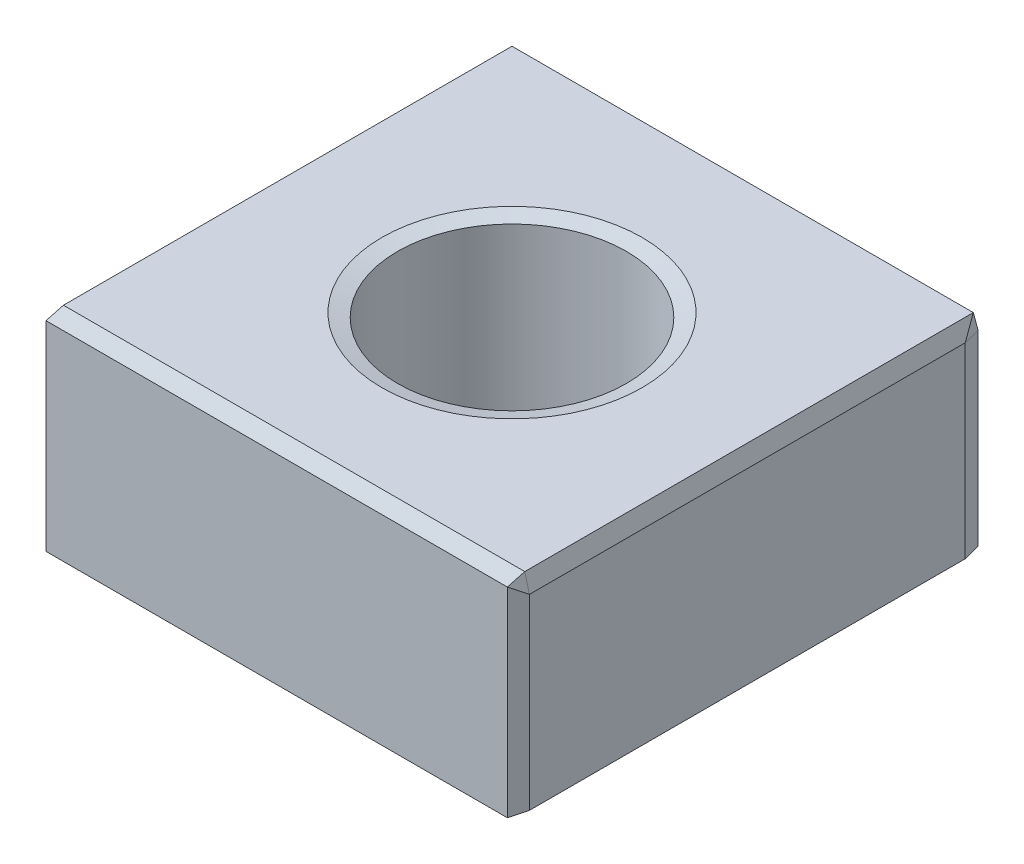
from build123d import *
from OCP.BRepFilletAPI import BRepFilletAPI_MakeChamfer

# Parameters (mm, degrees)
SKETCH1_W             = 54
SKETCH1_H             = 54
BOSS_EXTRUDE1_DEPTH   = 24
M24_CLEARANCE_HOLE1_D = 26.26
CHAMFER2_SIZE         = 1.8
CHAMFER2_SIZE2        = 0.482308546


with BuildPart() as part:
    # Sketch1 → Boss-Extrude1 (new body)
    with BuildSketch(Plane(origin=(0, 0, 0), x_dir=(1, 0, 0), z_dir=(0, 1, 0))):
        Rectangle(SKETCH1_W, SKETCH1_H)
    extrude(amount=BOSS_EXTRUDE1_DEPTH)

    # Chamfer1
    # the kernel refuses this chamfer: 2, 0.535898385 mm, written as the material it takes off along each edge
    with BuildSketch(Plane(origin=(26.64273441, 22.666666667, -26.154700538), x_dir=(0.25881904510252285, 0, 0.9659258262890678), z_dir=(0.9636113749942796, 0.0691841839943633, -0.2581988897471632)), Plane(origin=(-26.154700538, 22.666666667, -26.64273441), x_dir=(0.9659258262890678, 0, -0.25881904510252285), z_dir=(-0.2581988897471632, 0.0691841839943633, -0.9636113749942796))) as chamfer1_piece_1:
        Polygon((-0.86273015, 0.668267901), (1.20782221, 0.668267901), (-0.34509206, -1.336535802), align=None)
    extrude(amount=0.720242762, mode=Mode.SUBTRACT)
    with BuildSketch(Plane(origin=(26.64273441, 23.154700538, 25.666666667), x_dir=(0.21132486540518758, -0.5773502691896254, -0.788675134594813), z_dir=(0.9636113749942801, 0.2581988897471616, 0.06918418399436459))) as chamfer1_piece_2:
        Polygon((-1.267949192, -0.545638456), (1.267949192, -0.545638456), (0, 1.091276912), align=None)
    extrude(amount=0.720242762, mode=Mode.SUBTRACT)
    with BuildSketch(Plane(origin=(26.154700538, 0.35726559, -25.666666667), x_dir=(0.25881904510252285, 0, 0.9659258262890678), z_dir=(0.2581988897471617, -0.9636113749942801, -0.06918418399436507)), Plane(origin=(-25.666666667, 0.35726559, -26.154700538), x_dir=(0.9659258262890678, 0, -0.25881904510252285), z_dir=(-0.06918418399436507, -0.9636113749942801, -0.2581988897471617)), Plane(origin=(-26.154700538, 0.35726559, 25.666666667), x_dir=(-0.25881904510252124, 0, -0.9659258262890682), z_dir=(-0.2581988897471617, -0.9636113749942801, 0.0691841839943646))) as chamfer1_piece_3:
        Polygon((-1.20782221, -0.668267901), (0.86273015, -0.668267901), (0.34509206, 1.336535802), align=None)
    extrude(amount=0.720242762, mode=Mode.SUBTRACT)
    with BuildSketch(Plane(origin=(26.154700538, 0.35726559, 25.666666667), x_dir=(0.25881904510252124, 0, -0.9659258262890682), z_dir=(0.2581988897471617, -0.9636113749942801, 0.0691841839943646))) as chamfer1_piece_4:
        Polygon((-1.20782221, 0.668267901), (0.86273015, 0.668267901), (0.34509206, -1.336535802), align=None)
    extrude(amount=0.720242762, mode=Mode.SUBTRACT)
    with BuildSketch(Plane(origin=(-26.64273441, 23.154700538, 25.666666667), x_dir=(-0.21132486540518758, -0.5773502691896254, -0.788675134594813), z_dir=(-0.9636113749942801, 0.2581988897471616, 0.06918418399436459))) as chamfer1_piece_5:
        Polygon((-1.267949192, 0.545638456), (1.267949192, 0.545638456), (0, -1.091276912), align=None)
    extrude(amount=0.720242762, mode=Mode.SUBTRACT)
    with BuildSketch(Plane(origin=(27, 24, -32.19344314), x_dir=(0.009967146577157254, -0.9999503267608395, 0), z_dir=(0, 0, 1)), Plane(origin=(-32.19344314, 24, -27), x_dir=(0, -0.9999503267608395, -0.009967146577157254), z_dir=(1, 0, 0)), Plane(origin=(-27, 24, 32.19344314), x_dir=(-0.009967146577157254, -0.9999503267608395, 0), z_dir=(0, 0, -1))) as chamfer1_piece_6:
        with BuildLine():
            Line((2.077377256, 0), (-0.08281798, -0.555806058))
            Line((-0.08281798, -0.555806058), (-0.122815993, -0.555407372))
            ThreePointArc((-0.122815993, -0.555407372), (-0.042771889, -0.277889444), (-0.039998013, 0.000398686))
            Line((-0.039998013, 0.000398686), (0.000398686, 0.039998013))
            ThreePointArc((0.000398686, 0.039998013), (1.038984126, 0.029645766), (2.077775942, 0.039998013))
            Line((2.077775942, 0.039998013), (2.077377256, 0))
        make_face()
    extrude(amount=64.386886281, mode=Mode.SUBTRACT)
    with BuildSketch(Plane(origin=(27, -5.19344314, -27), x_dir=(-0.9905000388259545, 0, -0.13751244702128856), z_dir=(0, 1, 0)), Plane(origin=(-27, -5.19344314, -27), x_dir=(-0.13751244702128856, 0, 0.9905000388259545), z_dir=(0, 1, 0)), Plane(origin=(-27, -5.19344314, 27), x_dir=(0.9905000388259545, 0, 0.13751244702128856), z_dir=(0, 1, 0))) as chamfer1_piece_7:
        with BuildLine():
            Line((0.561942339, 0), (-0.306159862, 2.054692776))
            Line((-0.306159862, 2.054692776), (-0.345779863, 2.049192278))
            ThreePointArc((-0.345779863, 2.049192278), (-0.182445522, 1.023269524), (-0.039620002, -0.005500498))
            Line((-0.039620002, -0.005500498), (0.005500498, -0.039620002))
            ThreePointArc((0.005500498, -0.039620002), (0.281158594, -0.001350019), (0.567442837, -0.039620002))
            Line((0.567442837, -0.039620002), (0.561942339, 0))
        make_face()
    extrude(amount=34.386886281, mode=Mode.SUBTRACT)
    with BuildSketch(Plane(origin=(27, -5.19344314, 27), x_dir=(-0.9905000388259544, 0, 0.13751244702128942), z_dir=(0, 1, 0))) as chamfer1_piece_8:
        with BuildLine():
            Line((0.561942339, 0), (-0.306159862, -2.054692776))
            Line((-0.306159862, -2.054692776), (-0.345779863, -2.049192278))
            ThreePointArc((-0.345779863, -2.049192278), (-0.182445522, -1.023269524), (-0.039620002, 0.005500498))
            Line((-0.039620002, 0.005500498), (0.005500498, 0.039620002))
            ThreePointArc((0.005500498, 0.039620002), (0.281158594, 0.001350019), (0.567442837, 0.039620002))
            Line((0.567442837, 0.039620002), (0.561942339, 0))
        make_face()
    extrude(amount=34.386886281, mode=Mode.SUBTRACT)
    with BuildSketch(Plane(origin=(-32.19344314, 0, -27), x_dir=(0, 0.9905000388259544, -0.1375124470212898), z_dir=(1, 0, 0)), Plane(origin=(27, 0, -32.19344314), x_dir=(0.13751244702128979, 0.9905000388259542, 0), z_dir=(0, 0, 1)), Plane(origin=(32.19344314, 0, 27), x_dir=(0, 0.9905000388259544, 0.1375124470212898), z_dir=(-1, 0, 0)), Plane(origin=(-27, 0, 32.19344314), x_dir=(-0.13751244702128979, 0.9905000388259542, 0), z_dir=(0, 0, -1))) as chamfer1_piece_9:
        with BuildLine():
            Line((0.561942339, 0), (-0.306159862, 2.054692776))
            Line((-0.306159862, 2.054692776), (-0.345779863, 2.049192278))
            ThreePointArc((-0.345779863, 2.049192278), (-0.182445522, 1.023269524), (-0.039620002, -0.005500498))
            Line((-0.039620002, -0.005500498), (0.005500498, -0.039620002))
            ThreePointArc((0.005500498, -0.039620002), (0.281158594, -0.001350019), (0.567442837, -0.039620002))
            Line((0.567442837, -0.039620002), (0.561942339, 0))
        make_face()
    extrude(amount=64.386886281, mode=Mode.SUBTRACT)
    with BuildSketch(Plane(origin=(32.19344314, 24, 27), x_dir=(0, -0.9905000388259544, 0.13751244702128942), z_dir=(-1, 0, 0))) as chamfer1_piece_10:
        with BuildLine():
            Line((0.561942339, 0), (-0.306159862, -2.054692776))
            Line((-0.306159862, -2.054692776), (-0.345779863, -2.049192278))
            ThreePointArc((-0.345779863, -2.049192278), (-0.182445522, -1.023269524), (-0.039620002, 0.005500498))
            Line((-0.039620002, 0.005500498), (0.005500498, 0.039620002))
            ThreePointArc((0.005500498, 0.039620002), (0.281158594, 0.001350019), (0.567442837, 0.039620002))
            Line((0.567442837, 0.039620002), (0.561942339, 0))
        make_face()
    extrude(amount=64.386886281, mode=Mode.SUBTRACT)

    # M24 Clearance Hole1 (through all)
    with Locations(Plane(origin=(0, 24, 0), x_dir=(1, 0, 0), z_dir=(0, 1, 0))):
        with Locations((0, 0)):
            Hole(M24_CLEARANCE_HOLE1_D / 2)

    # Chamfer2: one chamfer whose edges measure the first distance from different faces: ONE call of the kernel's chamfer builder (chamfer() names one face for all edges)
    chamfer2_edges_1 = [part.edges().sort_by_distance(p)[0] for p in [
        (13.13, 24, 0),
    ]]
    chamfer2_side_1 = [part.faces().sort_by_distance(p)[0] for p in [
        (0, 24, -25.725863953),
    ]]
    chamfer2_edges_2 = [part.edges().sort_by_distance(p)[0] for p in [
        (13.13, 0, 0),
    ]]
    chamfer2_side_2 = [part.faces().sort_by_distance(p)[0] for p in [
        (13.13, 12, 0),
    ]]
    chamfer2 = BRepFilletAPI_MakeChamfer(part.part.solid().wrapped)
    for e in chamfer2_edges_1:
        chamfer2.Add(CHAMFER2_SIZE, CHAMFER2_SIZE2, e.wrapped, chamfer2_side_1[0].wrapped)  # the first distance lies on this face
    for e in chamfer2_edges_2:
        chamfer2.Add(CHAMFER2_SIZE, CHAMFER2_SIZE2, e.wrapped, chamfer2_side_2[0].wrapped)  # the first distance lies on this face
    add(Compound.cast(chamfer2.Shape()), mode=Mode.REPLACE)


solid = part.part
